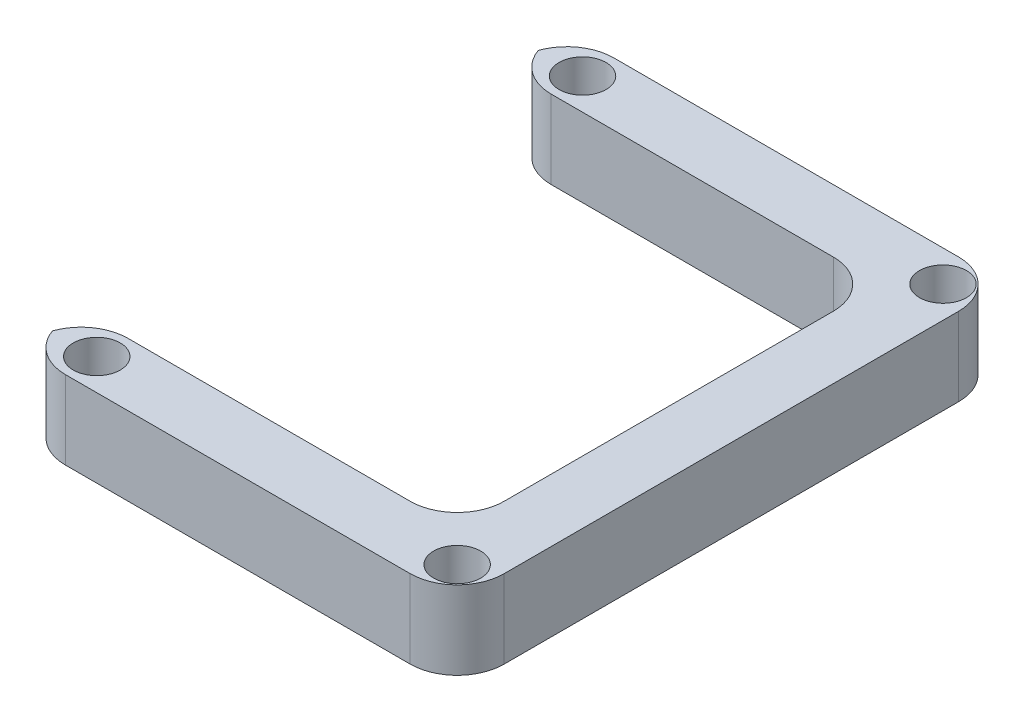
from build123d import *

# Parameters (mm, degrees)
SKETCH1_R           = 1.5
BOSS_EXTRUDE1_DEPTH = 5
FILLET2_R           = 3


with BuildPart() as part:
    # Sketch1 → Boss-Extrude1 (new body)
    with BuildSketch(Plane(origin=(0, 0, 0), x_dir=(1, 0, 0), z_dir=(0, 1, 0))):
        Polygon((0, 31), (0, 35), (28, 35), (28, 0), (0, 0), (0, 4), (24, 4), (24, 31), align=None)
        with Locations(Location((26, 2, 0), (0, 0, 270))):
            Circle(SKETCH1_R, mode=Mode.SUBTRACT)
        with Locations(Location((26, 33, 0), (0, 0, 270))):
            Circle(SKETCH1_R, mode=Mode.SUBTRACT)
        with Locations(Location((3, 33, 0), (0, 0, 270))):
            Circle(SKETCH1_R, mode=Mode.SUBTRACT)
        with Locations(Location((3, 2, 0), (0, 0, 270))):
            Circle(SKETCH1_R, mode=Mode.SUBTRACT)
    extrude(amount=BOSS_EXTRUDE1_DEPTH)

    # Fillet2
    # the kernel refuses this fillet: 3 mm, written as the material it adds along each edge
    with BuildSketch(Plane(origin=(24, 0, -31), x_dir=(0, 0, 1), z_dir=(0, 1, 0)), Plane(origin=(24, 0, -4), x_dir=(-1, 0, 0), z_dir=(0, 1, 0))) as fillet2_piece_1:
        with BuildLine():
            CenterArc((FILLET2_R, -FILLET2_R), FILLET2_R, 90, 90)
            Line((0, -FILLET2_R), (0, 0))
            Line((0, 0), (FILLET2_R, 0))
        make_face()
    extrude(amount=5)
    # the kernel refuses this fillet: 3 mm, written as the material it takes off along each edge
    with BuildSketch(Plane(origin=(28, -7.5, -35), x_dir=(-1, 0, 0), z_dir=(0, 1, 0)), Plane(origin=(0, -7.5, -35), x_dir=(0, 0, 1), z_dir=(0, 1, 0)), Plane(origin=(0, -7.5, -4), x_dir=(0, 0, 1), z_dir=(0, 1, 0)), Plane(origin=(0, -7.5, 0), x_dir=(1, 0, 0), z_dir=(0, 1, 0)), Plane(origin=(28, -7.5, 0), x_dir=(0, 0, -1), z_dir=(0, 1, 0))) as fillet2_2_piece_1:
        with BuildLine():
            CenterArc((FILLET2_R, FILLET2_R), FILLET2_R, 180, 90)
            Line((0, FILLET2_R), (0, 0))
            Line((0, 0), (FILLET2_R, 0))
        make_face()
    extrude(amount=20, mode=Mode.SUBTRACT)
    with BuildSketch(Plane(origin=(0, -7.5, -31), x_dir=(0, 0, -1), z_dir=(0, 1, 0))) as fillet2_2_piece_2:
        with BuildLine():
            CenterArc((FILLET2_R, -FILLET2_R), FILLET2_R, 90, 90)
            Line((0, -FILLET2_R), (0, 0))
            Line((0, 0), (FILLET2_R, 0))
        make_face()
    extrude(amount=20, mode=Mode.SUBTRACT)


solid = part.part
